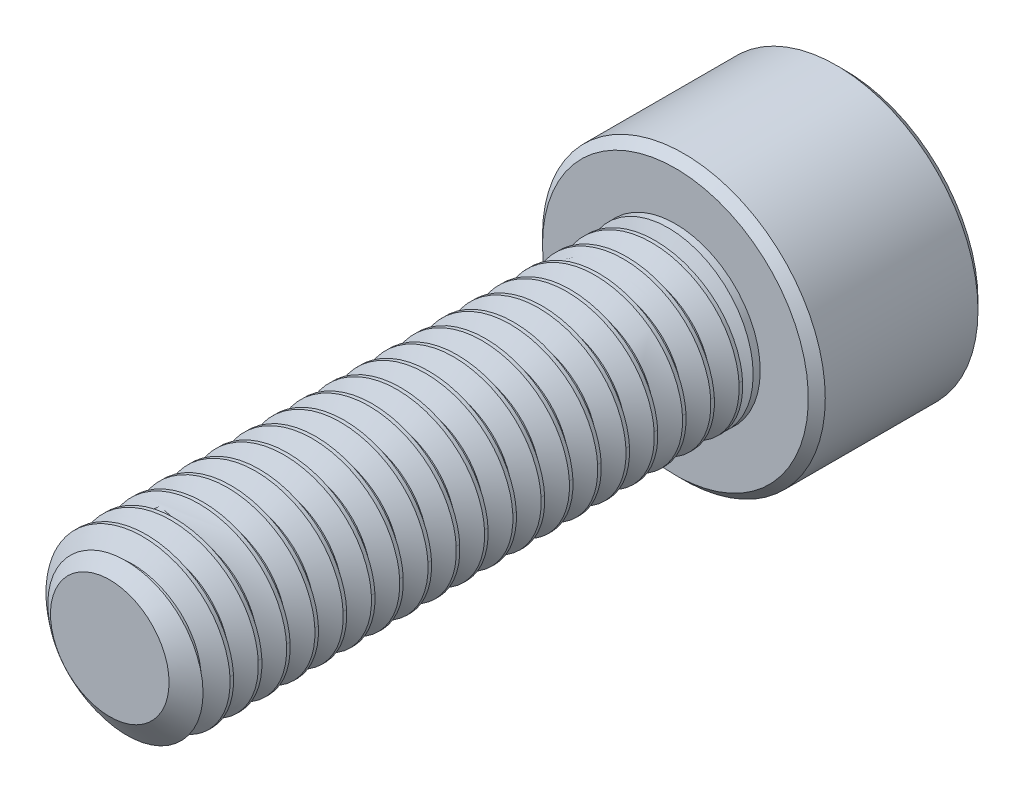
from build123d import *

# Parameters (mm, degrees)
SKETCH1_R          = 3
EXTRUDE1_DEPTH     = 20
CUT_SWEEP1_PITCH   = 1
SKETCH6_R          = 5
EXTRUDE2_DEPTH     = 6
CUT_EXTRUDE1_DEPTH = 3.75
CHAMFER1_SIZE      = 0.3


with BuildPart() as part:
    # Sketch1 → Extrude1 (new body)
    with BuildSketch(Plane.XY):
        Circle(SKETCH1_R)
    extrude(amount=-EXTRUDE1_DEPTH)

    # Cut-Sweep1: arcs per turn and ends read off the stored shape
    # Cut-Sweep1: the profile of Sketch3 profile screwed along a right-hand helix through 23 turns, 6 arcs to a turn; built about Z, then put on its axis
    cut_sweep1_z = Axis((0, 0, 0), (0, 0, 1))
    cut_sweep1_corners = [(3.0003, 0, -1.875173205), (2.350480947, 0, -1.5), (2.350480947, 0, -1.375), (3.0003, 0, -0.999826795)]
    with BuildLine(mode=Mode.PRIVATE) as cut_sweep1_profile:
        Line(cut_sweep1_corners[0], cut_sweep1_corners[1])
        Line(cut_sweep1_corners[1], cut_sweep1_corners[2])
        Line(cut_sweep1_corners[2], cut_sweep1_corners[3])
        Line(cut_sweep1_corners[3], cut_sweep1_corners[0])
    cut_sweep1_cap = Face(cut_sweep1_profile.wire())
    cut_sweep1_turn_angles = [0, 30, 60, 90, 120, 150, 180, 210, 240, 270, 300, 330, 360]
    cut_sweep1_turn_weights = [1, 0.8660254037844387, 1, 0.8660254037844387, 1, 0.8660254037844387, 1, 0.8660254037844387, 1, 0.8660254037844387, 1, 0.8660254037844387, 1]
    cut_sweep1_turn_rails = [Edge.make_bspline([Vector(p[0], p[1], 0).rotate(cut_sweep1_z, cut_sweep1_turn_angles[k]) / cut_sweep1_turn_weights[k] + Vector(0, 0, p[2] + CUT_SWEEP1_PITCH * cut_sweep1_turn_angles[k] / 360) for k in range(13)], [0, 0, 0, 1, 1, 2, 2, 3, 3, 4, 4, 5, 5, 6, 6, 6], 2, cut_sweep1_turn_weights) for p in cut_sweep1_corners]
    cut_sweep1_turn_sides = [Face.make_surface_from_curves(cut_sweep1_turn_rails[p[0]], cut_sweep1_turn_rails[p[1]]) for p in [(0, 1), (1, 2), (2, 3), (3, 0)]]
    cut_sweep1 = Plane(origin=(0, 0, 0), x_dir=(0, 1, 0), z_dir=(0, 0, -1)) * Solid(Shell([*[p.moved(Location((0, 0, CUT_SWEEP1_PITCH * i))) for i in range(23) for p in cut_sweep1_turn_sides], cut_sweep1_cap, cut_sweep1_cap.rotate(cut_sweep1_z, 8280).moved(Location((0, 0, CUT_SWEEP1_PITCH * 8280 / 360)))]))
    add(cut_sweep1, mode=Mode.SUBTRACT)

    # Sketch4 → Cut-Revolve1 (revolve, cut)
    with BuildSketch(Plane(origin=(0, 0, 0), x_dir=(0, 0, -1), z_dir=(1, 0, 0)), mode=Mode.PRIVATE) as cut_revolve1_sk:
        Polygon((0.632650852, 3), (0, 2.096480947), (0, 3), align=None)
    revolve(cut_revolve1_sk.sketch.rotate(Axis((0, 0, 0), (0, 0, -1)), 90), axis=Axis((0, 0, 0), (0, 0, -1)), mode=Mode.SUBTRACT)

    # Sketch6 → Extrude2 (add)
    with BuildSketch(Plane(origin=(0, 0, -20), x_dir=(-1, 0, 0), z_dir=(0, 0, -1))):
        with Locations(Location((0, 0, 0), (0, 0, 180))):
            Circle(SKETCH6_R)
    extrude(amount=EXTRUDE2_DEPTH)

    # Sketch7 → Cut-Extrude1 (cut)
    with BuildSketch(Plane(origin=(0, 0, -26), x_dir=(-1, 0, 0), z_dir=(0, 0, -1))):
        Polygon((0, 2.886751346), (-2.5, 1.443375673), (-2.5, -1.443375673), (0, -2.886751346), (2.5, -1.443375673), (2.5, 1.443375673), align=None)
    extrude(amount=-CUT_EXTRUDE1_DEPTH, mode=Mode.SUBTRACT)

    # Cut-Extrude2 cone 1 section (through the dimple's axis) → Cut-Extrude2 (revolve, cut)
    with BuildSketch(Plane(origin=(0, 0, -26), x_dir=(0, 1, 0), z_dir=(1, 0, 0))):
        Polygon((0, 0), (2.886751346, 0), (0, 2.886751346), align=None)
    revolve(axis=Axis((0, 0, -26), (0, 0, 1)), mode=Mode.SUBTRACT)

    # Chamfer1
    chamfer1_edges = [part.edges().sort_by_distance(p)[0] for p in [
        (-5, 0, -20),
        (-5, 0, -26),
    ]]
    chamfer(chamfer1_edges, length=CHAMFER1_SIZE)

    # Sketch10 → Revolve1 (revolve)
    with BuildSketch(Plane(origin=(0, 0, 0), x_dir=(0, 0, -1), z_dir=(1, 0, 0)), mode=Mode.PRIVATE) as revolve1_sk:
        Polygon((20, 3), (20, 0), (18.507359313, 0), (19.75, 3), align=None)
    revolve(revolve1_sk.sketch.rotate(Axis((0, 0, -20), (0, 0, 1)), 270), axis=Axis((0, 0, -20), (0, 0, 1)))


solid = part.part
